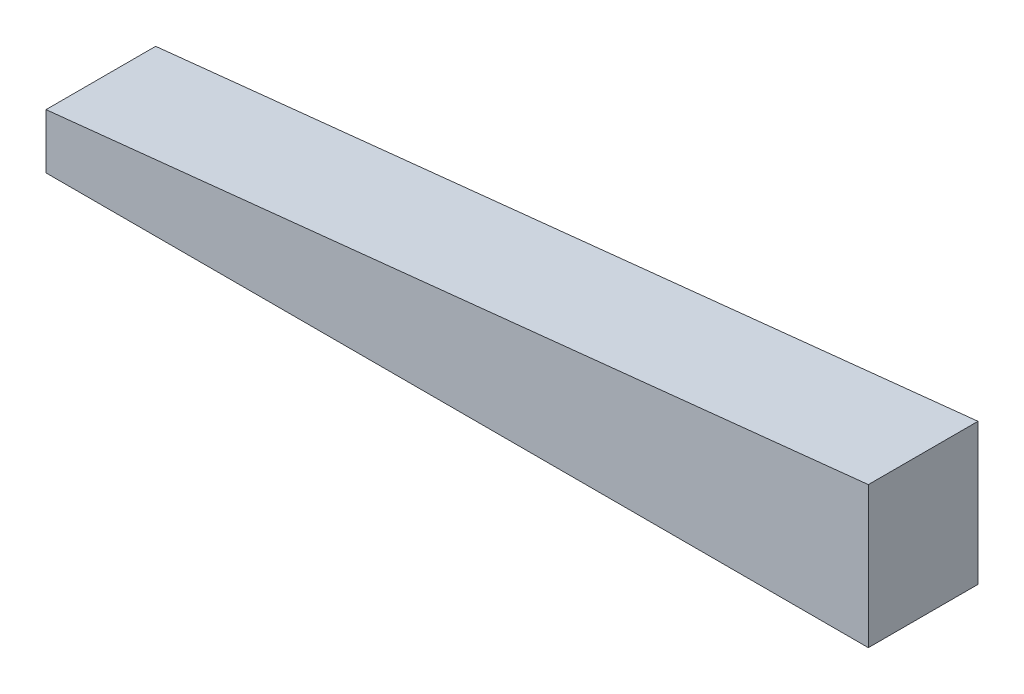
from build123d import *

# Parameters (mm, degrees)
SKETCH1_W           = 150
SKETCH1_H           = 20
BOSS_EXTRUDE1_DEPTH = 10
BOSS_EXTRUDE2_DEPTH = 10


with BuildPart() as part:
    # Sketch1 → Boss-Extrude1 (new body)
    with BuildSketch(Plane(origin=(0, 0, 0), x_dir=(1, 0, 0), z_dir=(0, 1, 0))):
        Rectangle(SKETCH1_W, SKETCH1_H)
    extrude(amount=BOSS_EXTRUDE1_DEPTH)

    # Sketch2 → Boss-Extrude2 (add, symmetric)
    with BuildSketch(Plane.XY):
        Polygon((-75, 10), (75, 10), (75, 25.76563529), align=None)
    extrude(amount=BOSS_EXTRUDE2_DEPTH, both=True)


solid = part.part
